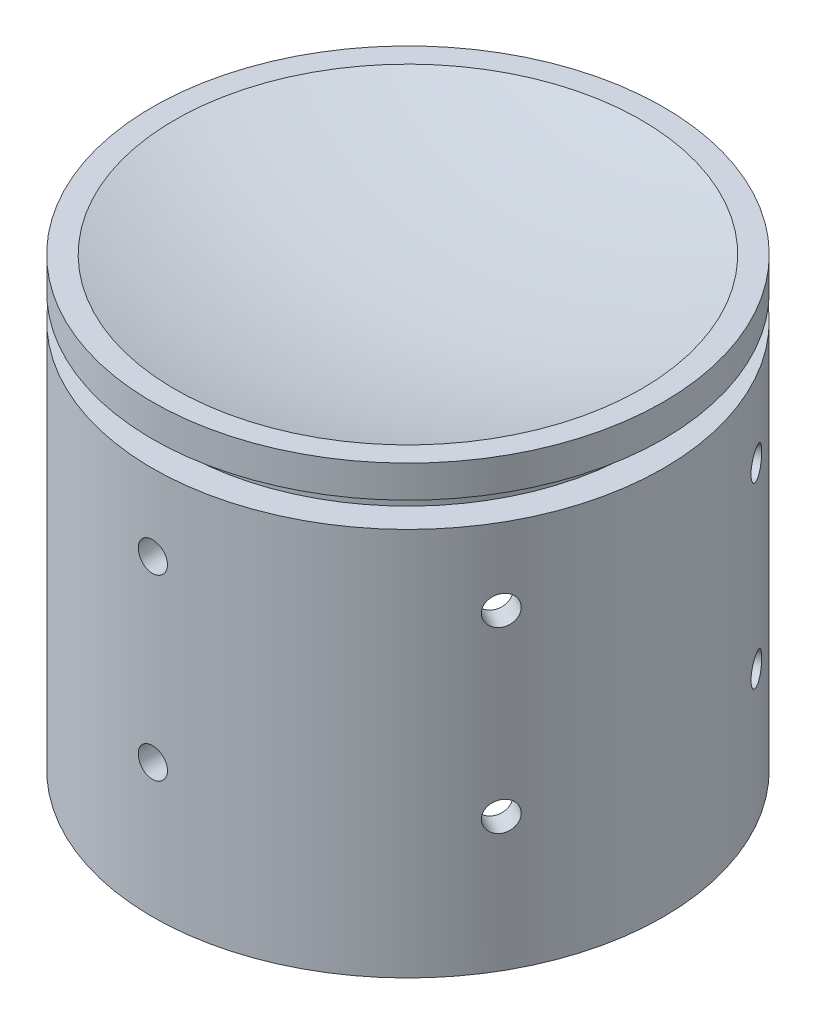
from build123d import *

# Parameters (mm, degrees)
F_19_0_164_DIAMETER_HOLE1_D = 4.1656
CIRPATTERN2_COUNT           = 6


with BuildPart() as part:
    # Sketch1 → Revolve2 (revolve)
    with BuildSketch(Plane.XY):
        with BuildLine():
            Line((33.2105, -10.16), (33.2105, -63.5))
            Line((33.2105, -63.5), (36.3855, -63.5))
            Line((36.3855, -63.5), (36.3855, -8.1788))
            Line((36.3855, -8.1788), (32.3215, -8.1788))
            Line((32.3215, -8.1788), (32.3215, -4.572))
            Line((32.3215, -4.572), (36.3855, -4.572))
            Line((36.3855, -4.572), (36.3855, 0))
            Line((36.3855, 0), (33.2105, 0))
            ThreePointArc((33.2105, 0), (16.798390624, -3.802656831), (0, -5.08))
            Line((0, -5.08), (0, -10.16))
            Line((0, -10.16), (33.2105, -10.16))
        make_face()
    revolve(axis=Axis((0, 0, 0), (0, -1, 0)))

    # #19 (0.164) Diameter Hole1 (through all)
    with Locations(Plane(origin=(0, -19.049997805, 36.3855), x_dir=(1, 0, 0), z_dir=(0, 0, 1))):
        with Locations((0, 0), (0, -25.400002195)):
            f_19_0_164_diameter_hole1 = Hole(F_19_0_164_DIAMETER_HOLE1_D / 2)

    # CirPattern2: #19 (0.164) Diameter Hole1 ×6 about axis
    cirpattern2_axis = Axis((0, 0, 0), (0, -1, 0))
    for i in range(1, CIRPATTERN2_COUNT):
        add(f_19_0_164_diameter_hole1.rotate(cirpattern2_axis, i * 360 / CIRPATTERN2_COUNT), mode=Mode.SUBTRACT)


solid = part.part
